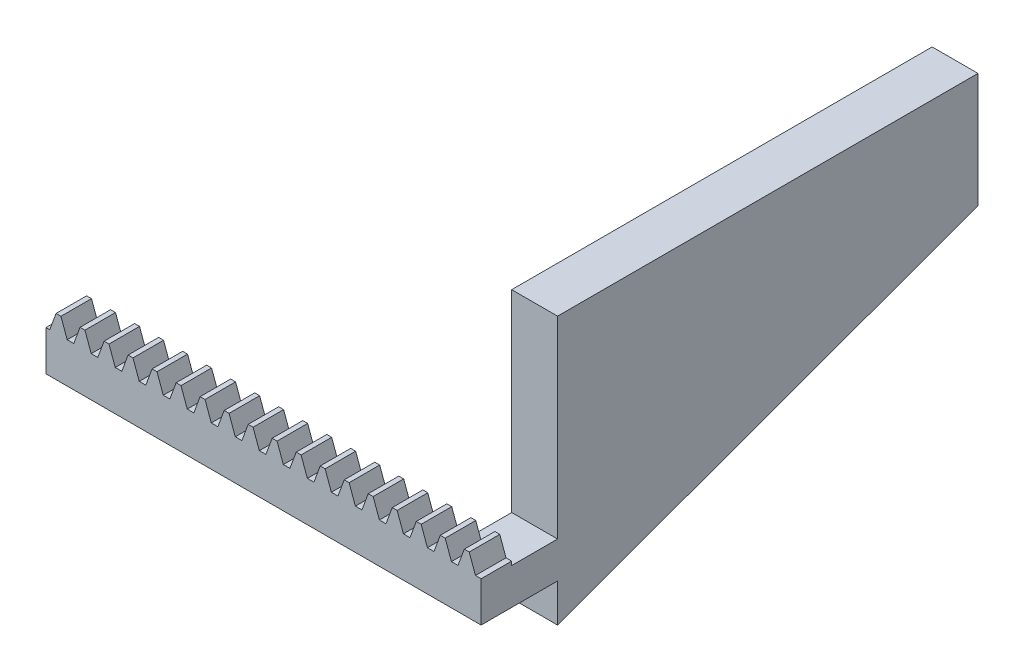
from build123d import *

# Parameters (mm, degrees)
BLANKSKE_W          = 120
BLANKSKE_H          = 16
BLANK_DEPTH         = 8
TOOTHCUTSIM_DEPTH   = 122.326007105
TEETHCUTS_COUNT     = 21
TEETHCUTS_PITCH     = 6.2831853
SKETCH1_W           = 8
SKETCH1_H           = 1
CUT_EXTRUDE1_DEPTH  = 122.326007105
BOSS_EXTRUDE2_DEPTH = 12
CUT_EXTRUDE2_DEPTH  = 188.138985783


with BuildPart() as part:
    # BlankSke → Blank (new body)
    with BuildSketch(Plane.XY):
        with Locations((60, 8)):
            Rectangle(BLANKSKE_W, BLANKSKE_H)
    extrude(amount=-BLANK_DEPTH)

    # TooCutSkeSim → ToothCutSim (cut, through all)
    with BuildSketch(Plane.XY):
        Polygon((0.861870739, 11.5), (-0.861870739, 11.5), (-2.508981637, 16.0254), (2.508981637, 16.0254), align=None)
    toothcutsim = extrude(amount=-TOOTHCUTSIM_DEPTH, mode=Mode.SUBTRACT)

    # TeethCuts: ToothCutSim ×21
    with Locations(*[(i * TEETHCUTS_PITCH, 0, 0) for i in range(1, TEETHCUTS_COUNT)]):
        add(toothcutsim, mode=Mode.SUBTRACT)

    # Sketch1 → Cut-Extrude1 (cut, through all)
    with BuildSketch(Plane(origin=(120, 0, 0), x_dir=(0, 0, -1), z_dir=(1, 0, 0))):
        with Locations((4, 0.5)):
            Rectangle(SKETCH1_W, SKETCH1_H)
    extrude(amount=-CUT_EXTRUDE1_DEPTH, mode=Mode.SUBTRACT)

    # Sketch2 → Boss-Extrude2 (add)
    with BuildSketch(Plane(origin=(120, 0, 0), x_dir=(0, 0, -1), z_dir=(1, 0, 0))):
        Polygon((8, 1), (20, 1), (20, -9), (130, 31), (130, 61), (20, 61), (20, 10.5), (8, 10.5), align=None)
    extrude(amount=-BOSS_EXTRUDE2_DEPTH)

    # Sketch3 → Cut-Extrude2 (cut, through all)
    with BuildSketch(Plane.XY):
        with BuildLine():
            Line((0, 1), (0, 11.5))
            ThreePointArc((0, 11.5), (0.43093537, 11.93093537), (0.861870739, 11.5))
            Line((0.861870739, 11.5), (2.499736794, 16))
            Line((2.499736794, 16), (3.783448506, 16))
            Line((3.783448506, 16), (5.421314561, 11.5))
            Line((5.421314561, 11.5), (6.161314561, 11.5))
            Line((6.161314561, 11.5), (6.161314561, 1))
            Line((6.161314561, 1), (0, 1))
        make_face()
    extrude(amount=-CUT_EXTRUDE2_DEPTH, mode=Mode.SUBTRACT)


solid = part.part
